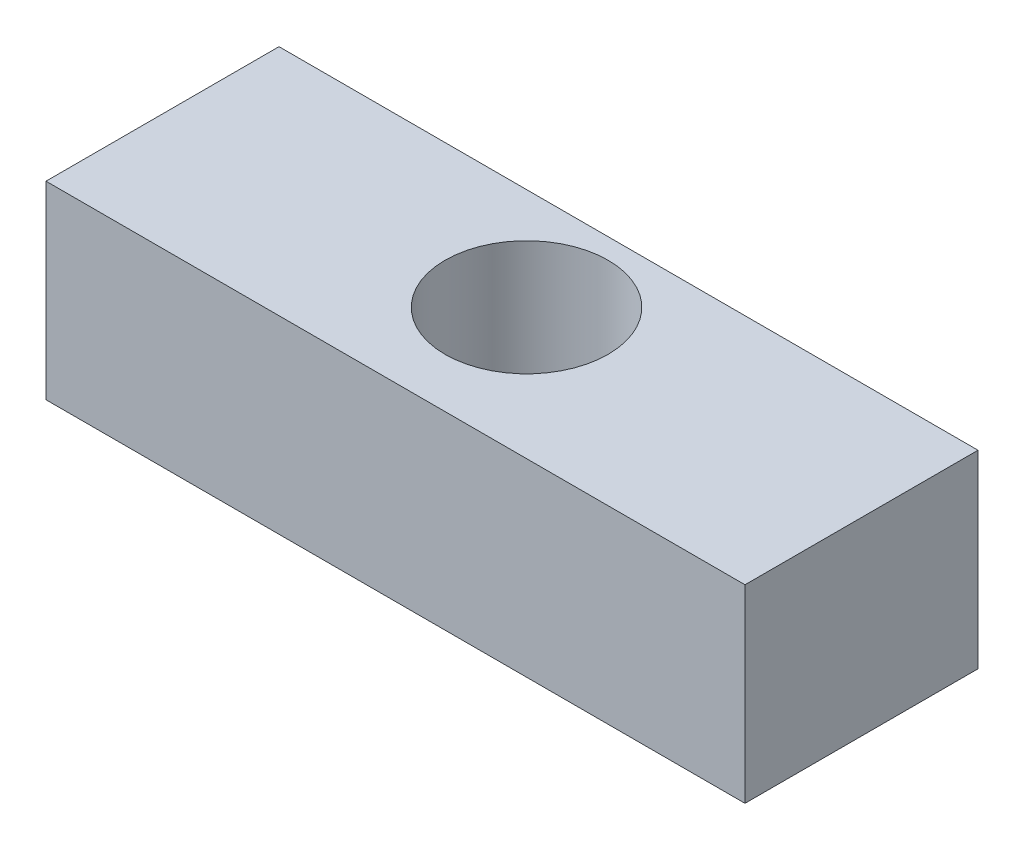
from build123d import *

# Parameters (mm, degrees)
SKETCH1_W           = 38.1
SKETCH1_H           = 12.7
SKETCH1_R           = 4.445
BOSS_EXTRUDE1_DEPTH = 10.31875


with BuildPart() as part:
    # Sketch1 → Boss-Extrude1 (new body)
    with BuildSketch(Plane(origin=(0, 0, 0), x_dir=(1, 0, 0), z_dir=(0, 1, 0))):
        with Locations((19.05, 6.35)):
            Rectangle(SKETCH1_W, SKETCH1_H)
        with Locations((19.05, 7.14375)):
            Circle(SKETCH1_R, mode=Mode.SUBTRACT)
    extrude(amount=BOSS_EXTRUDE1_DEPTH)


solid = part.part
